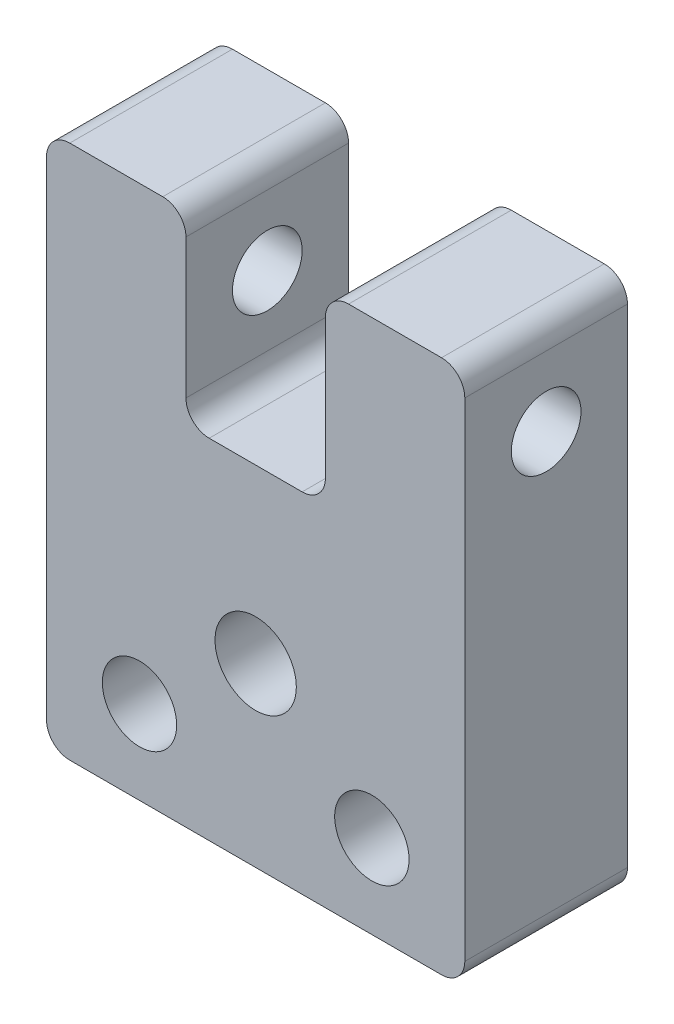
from build123d import *

# Parameters (mm, degrees)
CROQUIS1_R                 = 1.6
CROQUIS1_R_2               = 1.75
SALIENTE_EXTRUIR1_DEPTH    = 3.5
CORTAR_EXTRUIR1_DEPTH      = 16.016657418
CORTAR_EXTRUIR1_DEPTH_BACK = 16.016657418
CROQUIS2_R                 = 1.5
REDONDEO1_R                = 1


with BuildPart() as part:
    # Croquis1 → Saliente-Extruir1 (new, symmetric)
    with BuildSketch(Plane.XY):
        Polygon((3, 11.5), (9, 11.5), (9, -11.5), (-9, -11.5), (-9, 11.5), (-3, 11.5), (-3, 3.5), (3, 3.5), align=None)
        with Locations((5, -7.9)):
            Circle(CROQUIS1_R, mode=Mode.SUBTRACT)
        with Locations((-5, -7.9)):
            Circle(CROQUIS1_R, mode=Mode.SUBTRACT)
        with Locations((0, -3.9)):
            Circle(CROQUIS1_R_2, mode=Mode.SUBTRACT)
    extrude(amount=SALIENTE_EXTRUIR1_DEPTH, both=True)

    # Croquis2 → Cortar-Extruir1 (cut, two sides: drawn at the far end of the back side and taken through both)
    with BuildSketch(Plane(origin=(0, 0, 0), x_dir=(0, 0, -1), z_dir=(1, 0, 0)).offset(-CORTAR_EXTRUIR1_DEPTH_BACK)):
        with Locations((0, 7.5)):
            Circle(CROQUIS2_R)
    extrude(amount=CORTAR_EXTRUIR1_DEPTH + CORTAR_EXTRUIR1_DEPTH_BACK, mode=Mode.SUBTRACT)

    # Redondeo1
    redondeo1_edges = [part.edges().sort_by_distance(p)[0] for p in [
        (9, -11.5, 0),
        (-9, -11.5, 0),
        (-9, 11.5, 0),
        (-3, 11.5, 0),
        (-3, 3.5, 0),
        (3, 3.5, 0),
        (3, 11.5, 0),
        (9, 11.5, 0),
    ]]
    fillet(redondeo1_edges, radius=REDONDEO1_R)


solid = part.part
